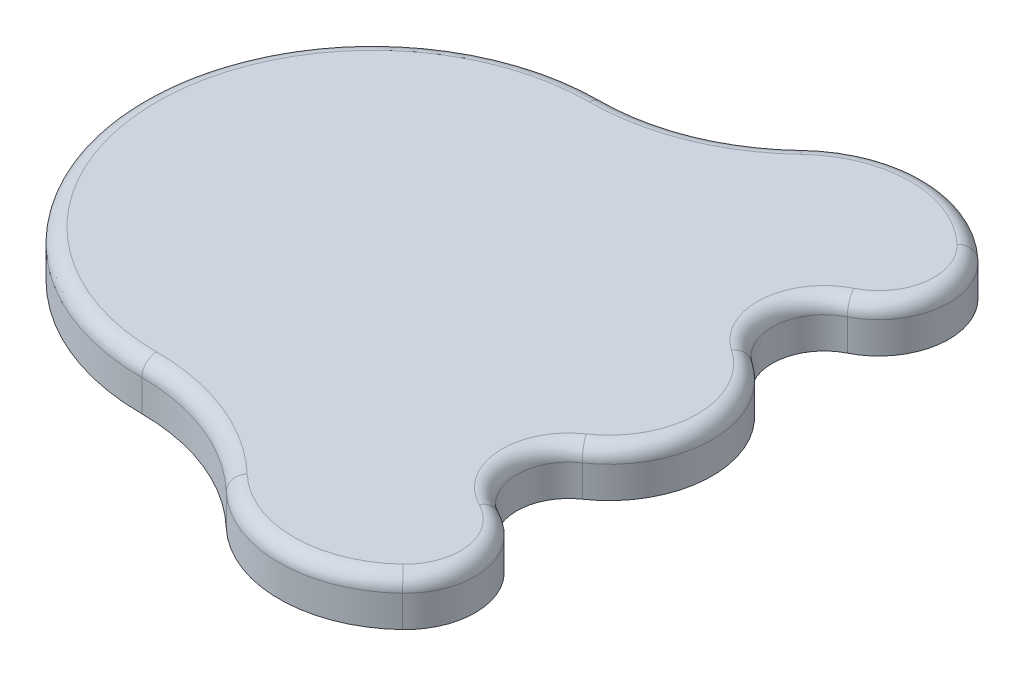
from build123d import *

# Parameters (mm, degrees)
BOSS_EXTRUDE1_DEPTH = 6.35
FILLET1_R           = 2.032


with BuildPart() as part:
    # Sketch1 → Boss-Extrude1 (new body)
    with BuildSketch(Plane(origin=(0, 0, 0), x_dir=(1, 0, 0), z_dir=(0, 1, 0))):
        with BuildLine():
            ThreePointArc((0, 31.75), (-31.75, 0), (0, -31.75))
            ThreePointArc((0, -31.75), (10.428639274, -33.76086621), (19.361922867, -39.505128064))
            ThreePointArc((19.361922867, -39.505128064), (31.474583484, -44.356672765), (43.587244101, -39.505128064))
            ThreePointArc((43.587244101, -39.505128064), (46.464756236, -31.095181881), (41.237325867, -23.906215152))
            ThreePointArc((41.237325867, -23.906215152), (37.316636573, -18.022674), (40.407157967, -11.663700928))
            ThreePointArc((40.407157967, -11.663700928), (46.57230733, 0), (40.407157967, 11.663700928))
            ThreePointArc((40.407157967, 11.663700928), (37.316636573, 18.022674), (41.237325867, 23.906215152))
            ThreePointArc((41.237325867, 23.906215152), (46.464756236, 31.095181881), (43.587244101, 39.505128064))
            ThreePointArc((43.587244101, 39.505128064), (31.474583484, 44.356672765), (19.361922867, 39.505128064))
            ThreePointArc((19.361922867, 39.505128064), (10.428639274, 33.76086621), (0, 31.75))
        make_face()
    extrude(amount=BOSS_EXTRUDE1_DEPTH)

    # Fillet1
    fillet1_edges = [part.edges().sort_by_distance(p)[0] for p in [
        (10.428639274, 6.35, -33.76086621),
        (31.474583484, 6.35, -44.356672765),
        (46.464756236, 6.35, -31.095181881),
        (37.316636573, 6.35, -18.022674),
        (46.57230733, 6.35, 0),
        (37.316636573, 6.35, 18.022674),
        (46.464756236, 6.35, 31.095181881),
        (31.474583484, 6.35, 44.356672765),
        (10.428639274, 6.35, 33.76086621),
        (-31.75, 6.35, 0),
    ]]
    fillet(fillet1_edges, radius=FILLET1_R)


solid = part.part
